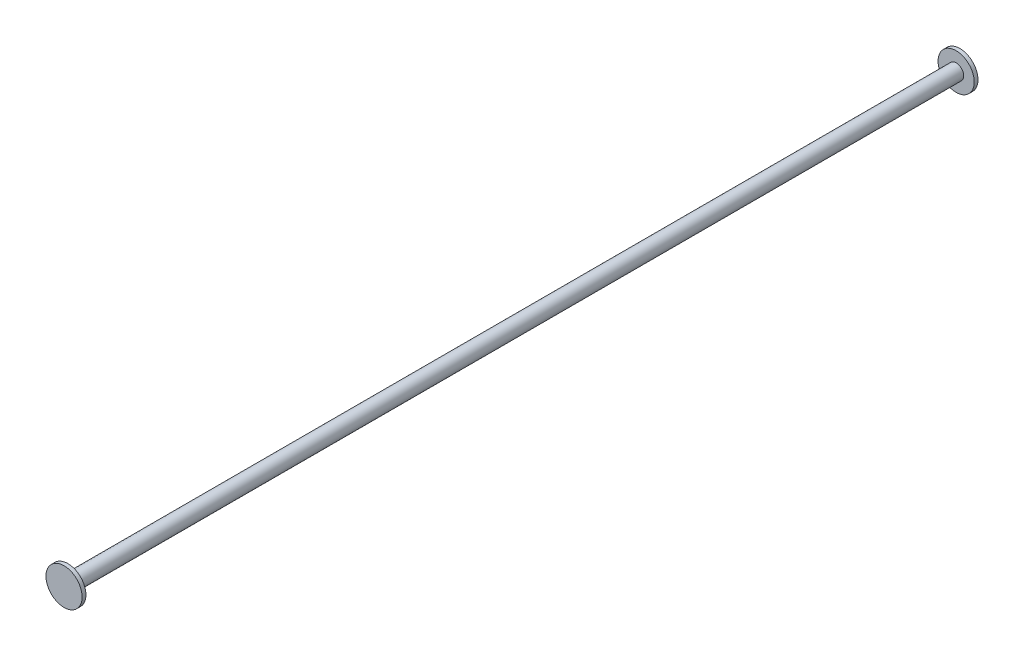
from build123d import *

# Parameters (mm, degrees)
SKETCH1_R           = 2
BOSS_EXTRUDE1_DEPTH = 117.5
SKETCH2_R           = 4.782586703
BOSS_EXTRUDE2_DEPTH = 1


with BuildPart() as part:
    # Sketch1 → Boss-Extrude1 (new, symmetric)
    with BuildSketch(Plane.XY):
        Circle(SKETCH1_R)
    extrude(amount=BOSS_EXTRUDE1_DEPTH, both=True)

    # Sketch2 → Boss-Extrude2 (add)
    with BuildSketch(Plane.XY.offset(117.5)):
        Circle(SKETCH2_R)
    boss_extrude2 = extrude(amount=BOSS_EXTRUDE2_DEPTH)

    # Mirror2: Boss-Extrude2 across plane
    add(boss_extrude2.mirror(Plane.XY))


solid = part.part
